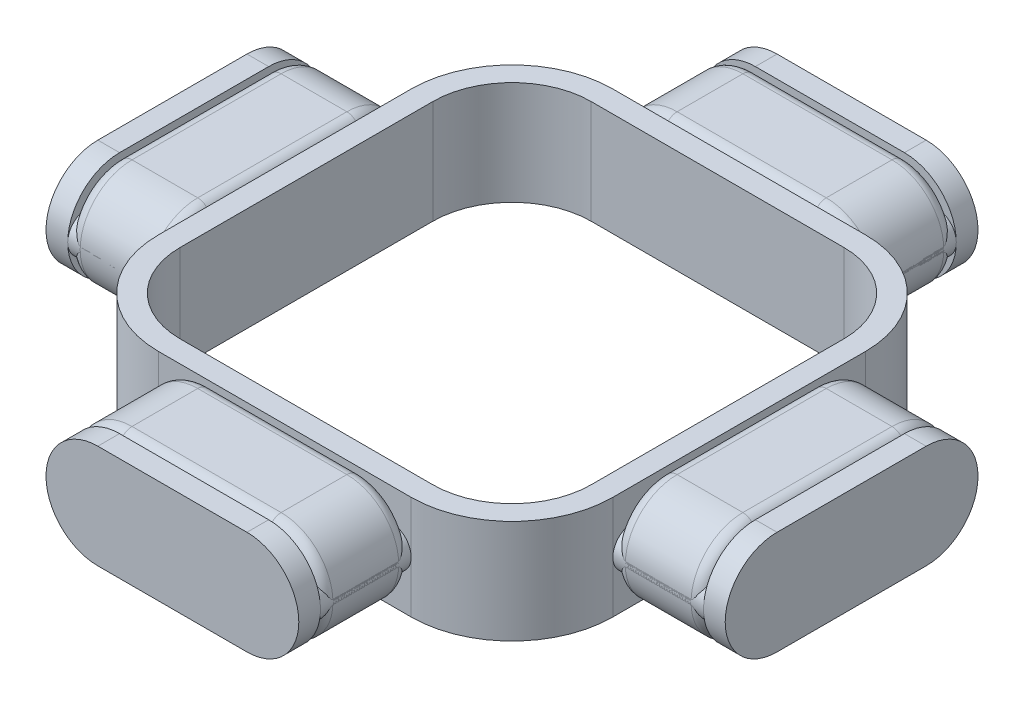
from build123d import *

# Parameters (mm, degrees)
BOSS_EXTRUDE3_DEPTH = 20.295
FILLET1_R           = 3.225953
FILLET2_R           = 3.225953
FILLET5_RADIUS      = 8.323635735
FILLET5_LENGTH      = 3.485878963
FILLET6_RADIUS      = 8.323635735
FILLET6_LENGTH      = 3.485878963
CIRPATTERN3_COUNT   = 4
BOSS_EXTRUDE4_START = -16.647271
BOSS_EXTRUDE4_DEPTH = 16.647271
BOSS_EXTRUDE5_DEPTH = 14.557348703
FILLET3_R           = 2
CIRPATTERN5_COUNT   = 4


with BuildPart() as part:
    # Sketch4 → Boss-Extrude3 (new, symmetric)
    with BuildSketch(Plane(origin=(0, 0, 0), x_dir=(0, 0, -1), z_dir=(1, 0, 0))):
        Polygon((-51.043227666, 0), (-54.529106628, 0), (-54.529106628, -16.64727147), (-51.043227666, -16.64727147), (-51.043227666, -11.549588473), (-36.485878963, -11.549588473), (-36.485878963, -16.64727147), (-33, -16.64727147), (-33, 0), (-36.485878963, 0), (-36.485878963, -5.097682997), (-51.043227666, -5.097682997), align=None)
    extrude(amount=BOSS_EXTRUDE3_DEPTH, both=True)

    # Fillet1
    fillet1_edges = [part.edges().sort_by_distance(p)[0] for p in [
        (20.295, -11.549588473, 43.764553314),
        (20.295, -5.097682997, 43.764553314),
    ]]
    fillet(fillet1_edges, radius=FILLET1_R - 0.0001)  # a hair under: the kernel refuses the full size

    # Fillet2
    fillet2_edges = [part.edges().sort_by_distance(p)[0] for p in [
        (-20.295, -5.097682997, 43.764553314),
        (-20.295, -11.549588473, 43.764553314),
    ]]
    fillet(fillet2_edges, radius=FILLET2_R - 0.0001)  # a hair under: the kernel refuses the full size

    # Fillet5: full round fillet: the end face becomes a half cylinder, R = half its width
    fillet5_face = Plane((20.295, -8.323635735, 52.786167147), x_dir=(0, 0, 1), z_dir=(1, 0, 0))  # on the end face: x along it, z out of the body
    fillet5_slab = fillet5_face.offset(-FILLET5_RADIUS / 2) * Box(FILLET5_LENGTH, 2 * FILLET5_RADIUS, FILLET5_RADIUS, mode=Mode.PRIVATE)  # the body's end, R deep
    fillet5_round = Plane((11.971364265, -8.323635735, 52.786167147), x_dir=(1, 0, 0), z_dir=(0, 0, 1)) * Cylinder(FILLET5_RADIUS, FILLET5_LENGTH, mode=Mode.PRIVATE)  # its axis R under the face
    add(fillet5_slab - fillet5_round, mode=Mode.SUBTRACT)

    # Fillet6: full round fillet: the end face becomes a half cylinder, R = half its width
    fillet6_face = Plane((-20.295, -8.323635735, 52.786167147), x_dir=(0, 0, -1), z_dir=(-1, 0, 0))  # on the end face: x along it, z out of the body
    fillet6_slab = fillet6_face.offset(-FILLET6_RADIUS / 2) * Box(FILLET6_LENGTH, 2 * FILLET6_RADIUS, FILLET6_RADIUS, mode=Mode.PRIVATE)  # the body's end, R deep
    fillet6_round = Plane((-11.971364265, -8.323635735, 52.786167147), x_dir=(-1, 0, 0), z_dir=(0, 0, -1)) * Cylinder(FILLET6_RADIUS, FILLET6_LENGTH, mode=Mode.PRIVATE)  # its axis R under the face
    add(fillet6_slab - fillet6_round, mode=Mode.SUBTRACT)


with BuildPart() as cirpattern3_1:
    # CirPattern3: pattern copy
    add(part.part.rotate(Axis((0, 0, 0), (0, 1, 0)), 1 * 360 / CIRPATTERN3_COUNT))


with BuildPart() as cirpattern3_2:
    # CirPattern3: pattern copy
    add(part.part.rotate(Axis((0, 0, 0), (0, 1, 0)), 2 * 360 / CIRPATTERN3_COUNT))


with BuildPart() as cirpattern3_3:
    # CirPattern3: pattern copy
    add(part.part.rotate(Axis((0, 0, 0), (0, 1, 0)), 3 * 360 / CIRPATTERN3_COUNT))


with BuildPart() as part_1:
    add(part.part)

    add(cirpattern3_1.part)  # Boss-Extrude4 merges CirPattern3_1

    add(cirpattern3_2.part)  # Boss-Extrude4 merges CirPattern3_2

    add(cirpattern3_3.part)  # Boss-Extrude4 merges CirPattern3_3
    # Sketch7 → Boss-Extrude4 (add)
    with BuildSketch(Plane(origin=(0, 0, 0), x_dir=(1, 0, 0), z_dir=(0, 1, 0)).offset(BOSS_EXTRUDE4_START)):
        with BuildLine():
            Line((-20.295, 36.485878963), (20.295, 36.485878963))
            ThreePointArc((20.295, 36.485878963), (31.743680308, 31.743680308), (36.485878963, 20.295))
            Line((36.485878963, 20.295), (36.485878963, -20.295))
            ThreePointArc((36.485878963, -20.295), (31.743680308, -31.743680308), (20.295, -36.485878963))
            Line((20.295, -36.485878963), (-20.295, -36.485878963))
            ThreePointArc((-20.295, -36.485878963), (-31.743680308, -31.743680308), (-36.485878963, -20.295))
            Line((-36.485878963, -20.295), (-36.485878963, 20.295))
            ThreePointArc((-36.485878963, 20.295), (-31.743680308, 31.743680308), (-20.295, 36.485878963))
        make_face()
        with BuildLine():
            Line((-20.295, 33), (20.295, 33))
            ThreePointArc((20.295, 33), (29.278791655, 29.278791655), (33, 20.295))
            Line((33, 20.295), (33, -20.295))
            ThreePointArc((33, -20.295), (29.278791655, -29.278791655), (20.295, -33))
            Line((20.295, -33), (-20.295, -33))
            ThreePointArc((-20.295, -33), (-29.278791655, -29.278791655), (-33, -20.295))
            Line((-33, -20.295), (-33, 20.295))
            ThreePointArc((-33, 20.295), (-29.278791655, 29.278791655), (-20.295, 33))
        make_face(mode=Mode.SUBTRACT)
    extrude(amount=BOSS_EXTRUDE4_DEPTH)


with BuildPart() as body_2:
    # Sketch9 → Boss-Extrude5 (new body)
    with BuildSketch(Plane.XY.offset(36.485878963)):
        with BuildLine():
            Line((-11.971364265, 0), (11.971364265, 0))
            ThreePointArc((11.971364265, 0), (20.295, -8.323635735), (11.971364265, -16.64727147))
            Line((11.971364265, -16.64727147), (-11.971364265, -16.64727147))
            ThreePointArc((-11.971364265, -16.64727147), (-20.295, -8.323635735), (-11.971364265, 0))
        make_face()
    extrude(amount=BOSS_EXTRUDE5_DEPTH)

    # Fillet3
    fillet3_edges = [body_2.edges().sort_by_distance(p)[0] for p in [
        (0, -16.64727147, 36.485878963),
        (20.295, -8.323635735, 36.485878963),
        (0, 0, 36.485878963),
        (0, 0, 51.043227666),
        (-20.295, -8.323635735, 51.043227666),
        (0, -16.64727147, 51.043227666),
        (20.295, -8.323635735, 51.043227666),
        (-20.295, -8.323635735, 36.485878963),
    ]]
    fillet(fillet3_edges, radius=FILLET3_R)


with BuildPart() as cirpattern5_1:
    # CirPattern5: pattern copy
    add(body_2.part.rotate(Axis((0, 0, 0), (0, 1, 0)), 1 * 360 / CIRPATTERN5_COUNT))


with BuildPart() as cirpattern5_2:
    # CirPattern5: pattern copy
    add(body_2.part.rotate(Axis((0, 0, 0), (0, 1, 0)), 2 * 360 / CIRPATTERN5_COUNT))


with BuildPart() as cirpattern5_3:
    # CirPattern5: pattern copy
    add(body_2.part.rotate(Axis((0, 0, 0), (0, 1, 0)), 3 * 360 / CIRPATTERN5_COUNT))


solid = Compound([part_1.part, body_2.part, cirpattern5_1.part, cirpattern5_2.part, cirpattern5_3.part])
